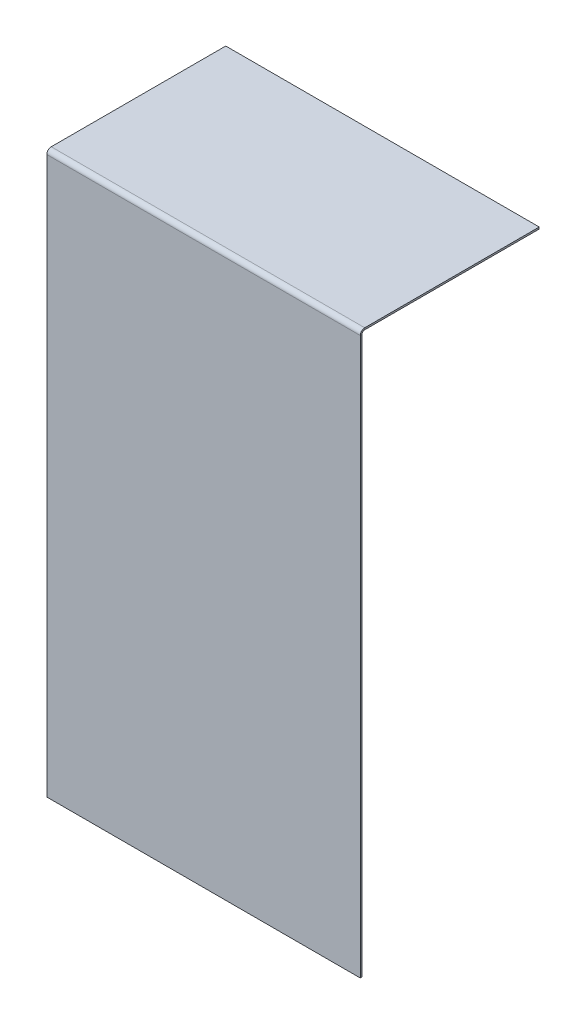
from build123d import *

# Parameters (mm, degrees)
SKETCH1_W              = 278.607499934
SKETCH1_H              = 496.8875
BOSS_EXTRUDE1_DEPTH    = 157.48
CONVERT_SOLID1_START   = -152.826113143
CONVERT_SOLID1_DEPTH   = 278.607499934
CONVERT_SOLID1_2_DEPTH = 278.607499934


# Read off the part's stored shape, not the designer's step: Convert-Solid1
with BuildPart() as part:
    # Sketch1 → Boss-Extrude1 (new body)
    with BuildSketch(Plane.XY):
        with Locations((-13.522363176, 152.341784507)):
            Rectangle(SKETCH1_W, SKETCH1_H)
    extrude(amount=BOSS_EXTRUDE1_DEPTH)

    # Convert-Solid1 outline → Convert-Solid1 (cut)
    with BuildSketch(Plane.YZ.offset(CONVERT_SOLID1_START)):
        with BuildLine():
            Line((398.405534441, 157.48), (-96.101965493, 157.48))
            Line((-96.101965493, 157.48), (-96.101965493, 0))
            Line((-96.101965493, 0), (400.785534507, 0))
            Line((400.785534507, 0), (400.785534507, 155.099999934))
            ThreePointArc((400.785534507, 155.099999934), (400.088448627, 156.78291412), (398.405534441, 157.48))
        make_face()
    extrude(amount=CONVERT_SOLID1_DEPTH, mode=Mode.SUBTRACT)

    # Convert-Solid1 2 outline → Convert-Solid1 2 (add)
    with BuildSketch(Plane.YZ.offset(CONVERT_SOLID1_START)):
        with BuildLine():
            Line((398.405534441, 159.0675), (-96.101965493, 159.0675))
            Line((-96.101965493, 159.0675), (-96.101965493, 157.48))
            Line((-96.101965493, 157.48), (400.785534507, 157.48))
            Line((400.785534507, 157.48), (400.785534507, 0))
            Line((400.785534507, 0), (402.373034507, 0))
            Line((402.373034507, 0), (402.373034507, 155.099999934))
            ThreePointArc((402.373034507, 155.099999934), (401.210980642, 157.905446136), (398.405534441, 159.0675))
        make_face()
    extrude(amount=CONVERT_SOLID1_2_DEPTH)


solid = part.part
